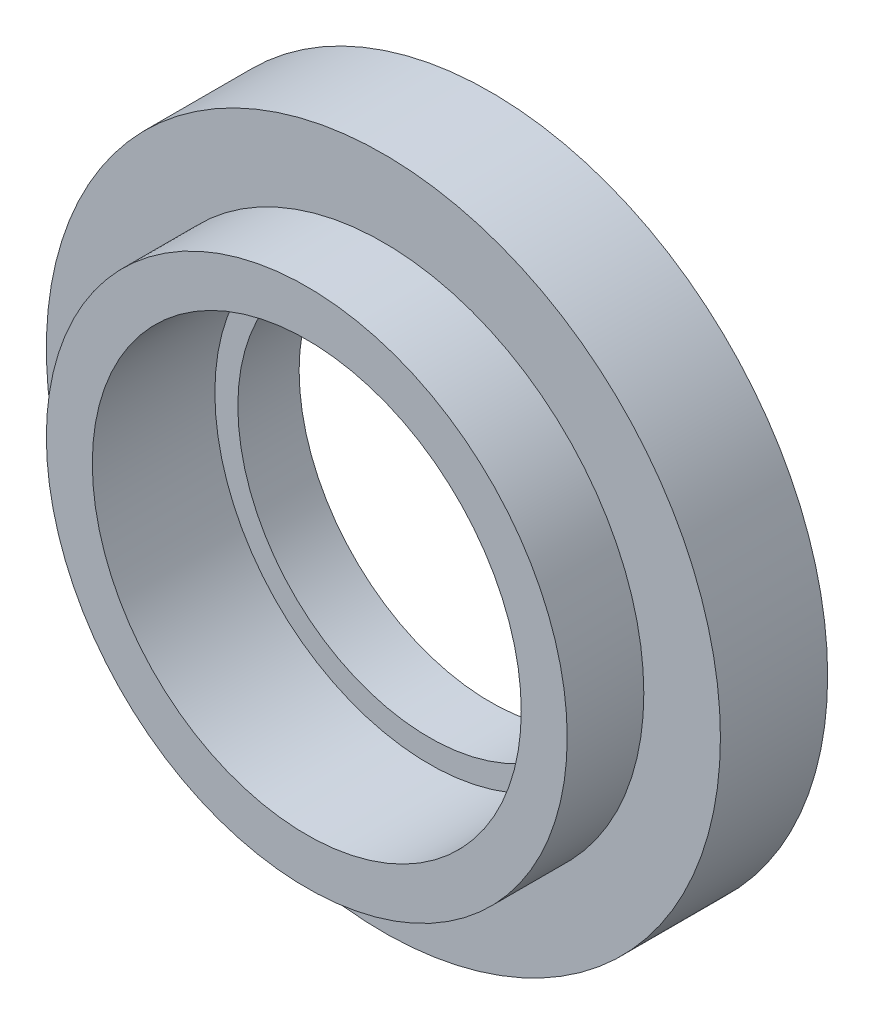
from build123d import *

# Parameters (mm, degrees)
SKETCH4_R          = 14
CUT_EXTRUDE1_DEPTH = 8
SKETCH5_R          = 12.5
CUT_EXTRUDE4_DEPTH = 8.1
SKETCH7_R          = 2.5
CUT_EXTRUDE5_DEPTH = 3


with BuildPart() as part:
    # Sketch2 → Revolve4 (revolve)
    with BuildSketch(Plane(origin=(0, 0, 0), x_dir=(1, 0, 0), z_dir=(0, 1, 0))):
        Polygon((0, 0), (-22, 0), (-22, -7), (-17, -7), (-17, -12), (0, -12), align=None)
    revolve(axis=Axis((0, 0, 12), (0, 0, -1)))

    # Sketch4 → Cut-Extrude1 (cut)
    with BuildSketch(Plane.XY.offset(12)):
        Circle(SKETCH4_R)
    extrude(amount=-CUT_EXTRUDE1_DEPTH, mode=Mode.SUBTRACT)

    # Sketch5 → Cut-Extrude4 (cut)
    with BuildSketch(Plane(origin=(0, 0, 0), x_dir=(-1, 0, 0), z_dir=(0, 0, -1))):
        Circle(SKETCH5_R)
    extrude(amount=-CUT_EXTRUDE4_DEPTH, mode=Mode.SUBTRACT)

    # Sketch7 → Cut-Extrude5 (cut)
    with BuildSketch(Plane(origin=(0, 0, 0), x_dir=(-1, 0, 0), z_dir=(0, 0, -1))):
        with Locations((0, 17)):
            Circle(SKETCH7_R)
        with Locations((14.722431864, 8.5)):
            Circle(SKETCH7_R)
        with Locations((14.722431864, -8.5)):
            Circle(SKETCH7_R)
        with Locations((0, -17)):
            Circle(SKETCH7_R)
        with Locations((-14.722431864, -8.5)):
            Circle(SKETCH7_R)
        with Locations((-14.722431864, 8.5)):
            Circle(SKETCH7_R)
    extrude(amount=-CUT_EXTRUDE5_DEPTH, mode=Mode.SUBTRACT)


solid = part.part
